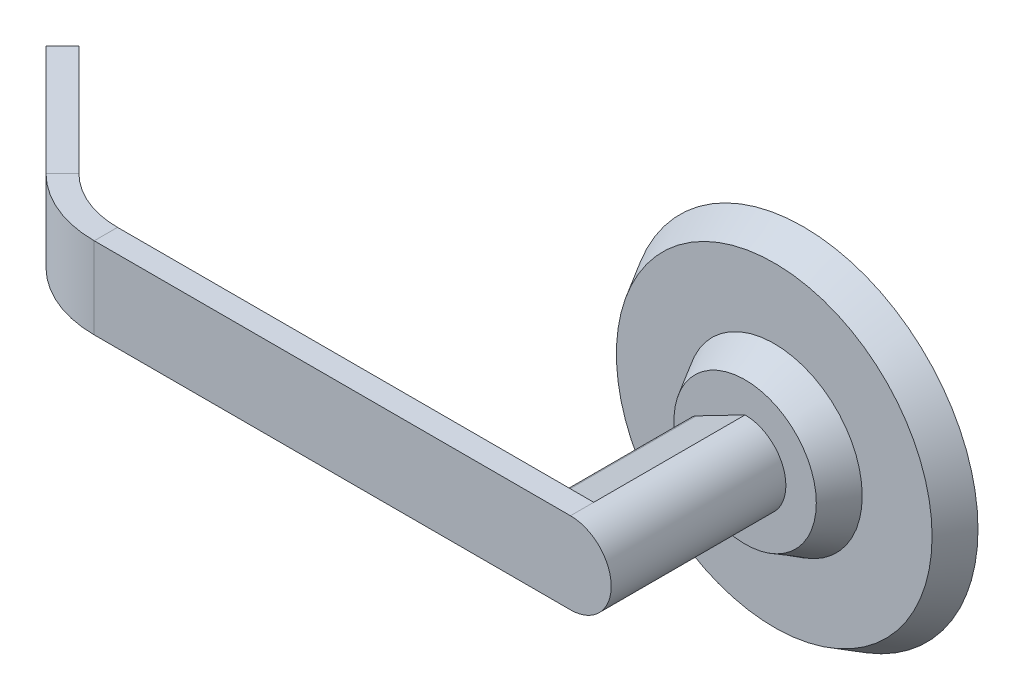
from build123d import *

# Parameters (mm, degrees)
BOSS_EXTRUDE1_DEPTH = 38.1
CUT_EXTRUDE1_START  = -5.08
CUT_EXTRUDE1_DEPTH  = 5.08
SWEEP1_START        = -8.89
SWEEP1_DEPTH        = 17.78


# Read off the part's stored shape, not the designer's step: Sweep1
with BuildPart() as part:
    # Sketch2 → Revolve1 (revolve)
    with BuildSketch(Plane(origin=(0, 0, 0), x_dir=(1, 0, 0), z_dir=(0, 1, 0))):
        Polygon((0, 50.8), (38.1, 50.8), (34.433825791, 44.45), (19.193825791, 44.45), (15.527651581, 38.1), (0, 38.1), align=None)
    revolve(axis=Axis((0, 0, 0), (0, 0, -1)))

    # Sketch3 → Boss-Extrude1 (add)
    with BuildSketch(Plane.XY.offset(-38.1)):
        with BuildLine():
            Line((0, 8.89), (-10.640962008, 3.383819151))
            ThreePointArc((-10.640962008, 3.383819151), (-12.7, 0), (-10.640962008, -3.383819151))
            Line((-10.640962008, -3.383819151), (0, -8.89))
            ThreePointArc((0, -8.89), (8.89, 0), (0, 8.89))
        make_face()
    extrude(amount=BOSS_EXTRUDE1_DEPTH)

    # Sketch4 → Cut-Extrude1 (cut)
    with BuildSketch(Plane.XY.offset(CUT_EXTRUDE1_START)):
        with BuildLine():
            Line((0, 8.89), (0, -8.89))
            Line((0, -8.89), (-10.640962008, -3.383819151))
            ThreePointArc((-10.640962008, -3.383819151), (-12.7, 0), (-10.640962008, 3.383819151))
            Line((-10.640962008, 3.383819151), (0, 8.89))
        make_face()
    extrude(amount=CUT_EXTRUDE1_DEPTH, mode=Mode.SUBTRACT)

    # Sweep1 outline → Sweep1 (add)
    with BuildSketch(Plane(origin=(0, 0, 0), x_dir=(1, 0, 0), z_dir=(0, 1, 0)).offset(SWEEP1_START)):
        with BuildLine():
            Line((-103.886, 0), (0, 0))
            Line((0, 0), (0, 5.08))
            Line((0, 5.08), (-103.886, 5.08))
            ThreePointArc((-103.886, 5.08), (-111.662127346, 6.626767899), (-118.254409794, 11.031590206))
            Line((-118.254409794, 11.031590206), (-142.321496198, 35.098676611))
            Line((-142.321496198, 35.098676611), (-145.913598647, 31.506574162))
            Line((-145.913598647, 31.506574162), (-121.846512242, 7.439487758))
            ThreePointArc((-121.846512242, 7.439487758), (-113.606159182, 1.933459874), (-103.886, 0))
        make_face()
    extrude(amount=SWEEP1_DEPTH)


solid = part.part
